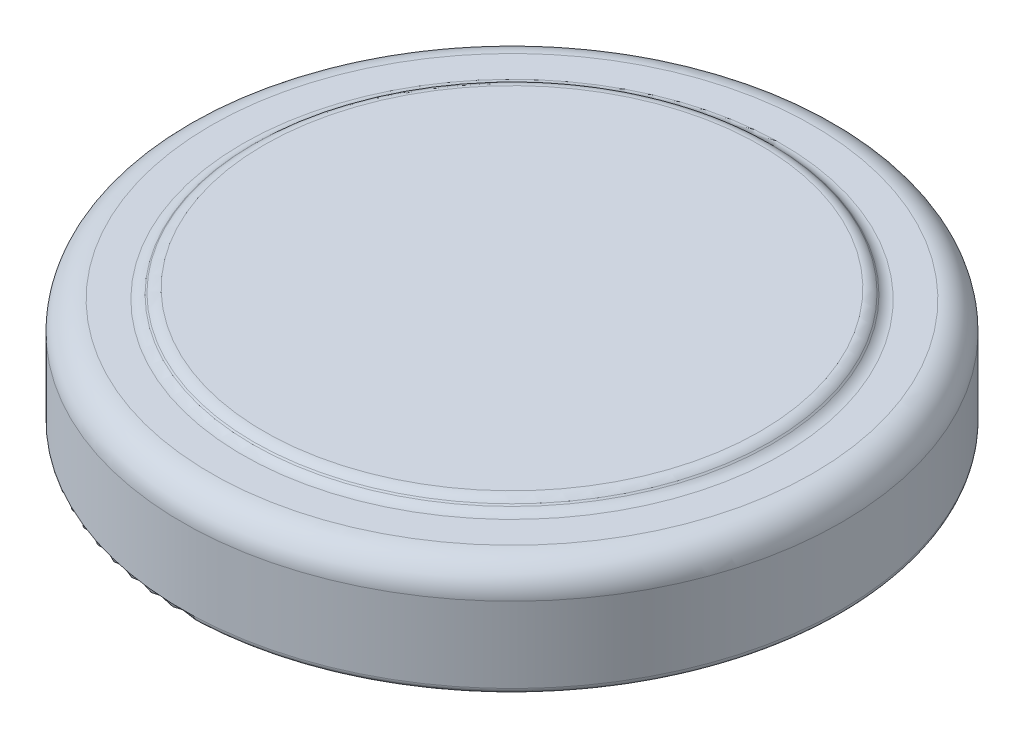
from build123d import *


with BuildPart() as part:
    # Sketch1 → Revolve1 (revolve)
    with BuildSketch(Plane.XY):
        with BuildLine():
            Line((0, 0), (-5.7, 0))
            ThreePointArc((-5.7, 0), (-5.770710678, 0.029289322), (-5.8, 0.1))
            Line((-5.8, 0.1), (-5.8, 1.43))
            ThreePointArc((-5.8, 1.43), (-5.653553391, 1.783553391), (-5.3, 1.93))
            Line((-5.3, 1.93), (-4.743553391, 1.93))
            ThreePointArc((-4.743553391, 1.93), (-4.647882533, 1.949030117), (-4.566776695, 2.003223305))
            Line((-4.566776695, 2.003223305), (-4.543223305, 2.026776695))
            ThreePointArc((-4.543223305, 2.026776695), (-4.462117467, 2.080969883), (-4.366446609, 2.1))
            Line((-4.366446609, 2.1), (0, 2.1))
            Line((0, 2.1), (0, 0))
        make_face()
    revolve(axis=Axis((0, 2.1, 0), (0, -1, 0)))


solid = part.part
